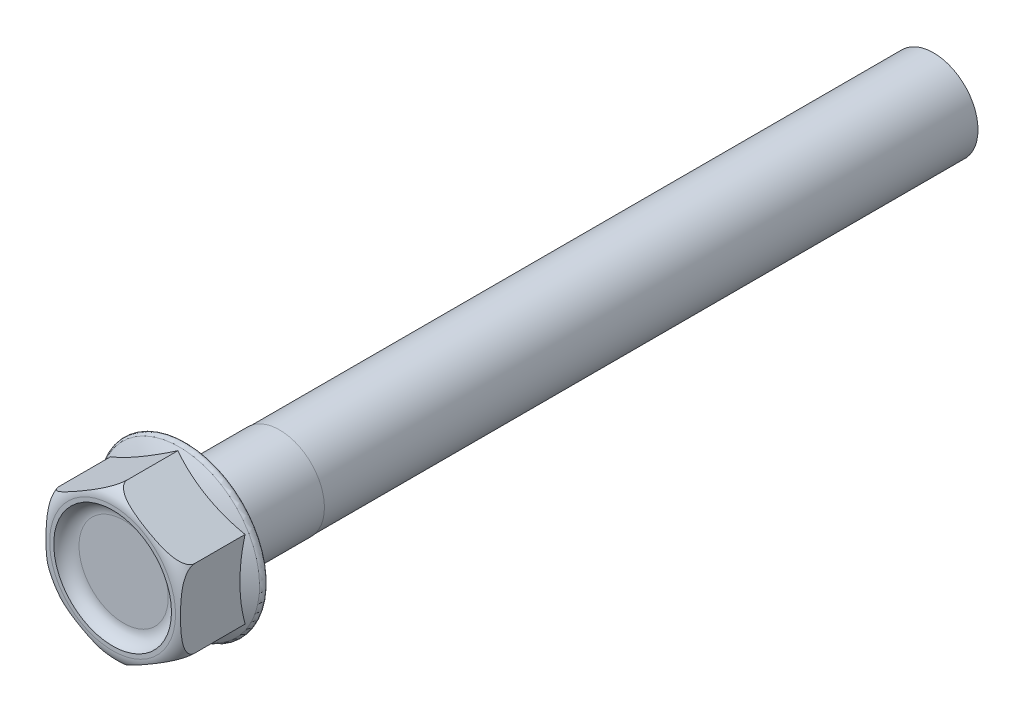
from build123d import *

# Parameters (mm, degrees)
HEAD_DEPTH     = 10
SHANK_SKETCH_R = 6.096
SHANK_DEPTH    = 101.6
SKETCH6_R      = 8.001
HEAD_CUT_DEPTH = 1.5
FILLET1_R      = 2
FILLET2_R      = 0.5
THREAD_END_W   = 88.9
THREAD_END_H   = 0.05


with BuildPart() as part:
    # Head Sketch → Head (new body)
    with BuildSketch(Plane.XY):
        Polygon((0, 10.558581723), (9.144, 5.279290861), (9.144, -5.279290861), (0, -10.558581723), (-9.144, -5.279290861), (-9.144, 5.279290861), align=None)
    extrude(amount=HEAD_DEPTH)

    # Shank Sketch → Shank (add)
    with BuildSketch(Plane.XY):
        Circle(SHANK_SKETCH_R)
    extrude(amount=-SHANK_DEPTH)

    # Sketch3 → Flange (revolve)
    with BuildSketch(Plane(origin=(0, 0, 0), x_dir=(-1, 0, 0), z_dir=(0, 1, 0)), mode=Mode.PRIVATE) as flange_sk:
        with BuildLine():
            Line((-10.668, 0), (0, 0))
            Line((0, 0), (0, 3.81))
            ThreePointArc((0, 3.81), (-5.643297007, 3.079227926), (-10.91431477, 0.935119563))
            ThreePointArc((-10.91431477, 0.935119563), (-11.151507901, 0.372641807), (-10.668, 0))
        make_face()
    revolve(flange_sk.sketch.rotate(Axis((0, 0, 0), (0, 0, 1)), 30), axis=Axis((0, 0, 0), (0, 0, 1)))

    # Sketch5 → Head Trim (revolve, cut)
    with BuildSketch(Plane(origin=(0, 0, 0), x_dir=(0, 0, -1), z_dir=(1, 0, 0)), mode=Mode.PRIVATE) as head_trim_sk:
        with BuildLine():
            Line((-10, -8.558581723), (-10, -10.558581723))
            Line((-10, -10.558581723), (-8, -10.558581723))
            ThreePointArc((-8, -10.558581723), (-9.414213562, -9.972795285), (-10, -8.558581723))
        make_face()
    revolve(head_trim_sk.sketch.rotate(Axis((0, 0, 15.085599173), (0, 0, -1)), 90), axis=Axis((0, 0, 15.085599173), (0, 0, -1)), mode=Mode.SUBTRACT)

    # Sketch6 → Head Cut (cut)
    with BuildSketch(Plane.XY.offset(10)):
        Circle(SKETCH6_R)
    extrude(amount=-HEAD_CUT_DEPTH, mode=Mode.SUBTRACT)

    # Fillet1
    # the kernel refuses this fillet: 2 mm, written as the material it adds along each edge
    with BuildSketch(Plane(origin=(0, 0, 8.5), x_dir=(1, 0, 0), z_dir=(0, -1, 0))) as fillet1_piece_1:
        with BuildLine():
            CenterArc((6.064508327, 2), FILLET1_R, 270, 75.522487814)
            Line((6.064508327, 0), (6.064508327, -0.04))
            Line((6.064508327, -0.04), (8.001, -0.04))
            Line((8.001, -0.04), (8.041, 0))
            ThreePointArc((8.041, 0), (8.041, 0.75), (8.039729833, 1.49))
            Line((8.039729833, 1.49), (8.001, 1.5))
        make_face()
    revolve(axis=Axis((0, 0, 8.5), (0, 0, 1)))

    # Fillet2
    fillet2_edges = [part.edges().sort_by_distance(p)[0] for p in [
        (-6.096, 0, 0),
    ]]
    fillet(fillet2_edges, radius=FILLET2_R)

    # Thread End → Thread Cut (revolve, cut)
    with BuildSketch(Plane(origin=(0, 0, 0), x_dir=(0, 0, -1), z_dir=(1, 0, 0)), mode=Mode.PRIVATE) as thread_cut_sk:
        with Locations((57.15, 6.071)):
            Rectangle(THREAD_END_W, THREAD_END_H)
    revolve(thread_cut_sk.sketch.rotate(Axis((0, 0, -21.551935625), (0, 0, -1)), 90), axis=Axis((0, 0, -21.551935625), (0, 0, -1)), mode=Mode.SUBTRACT)


solid = part.part
